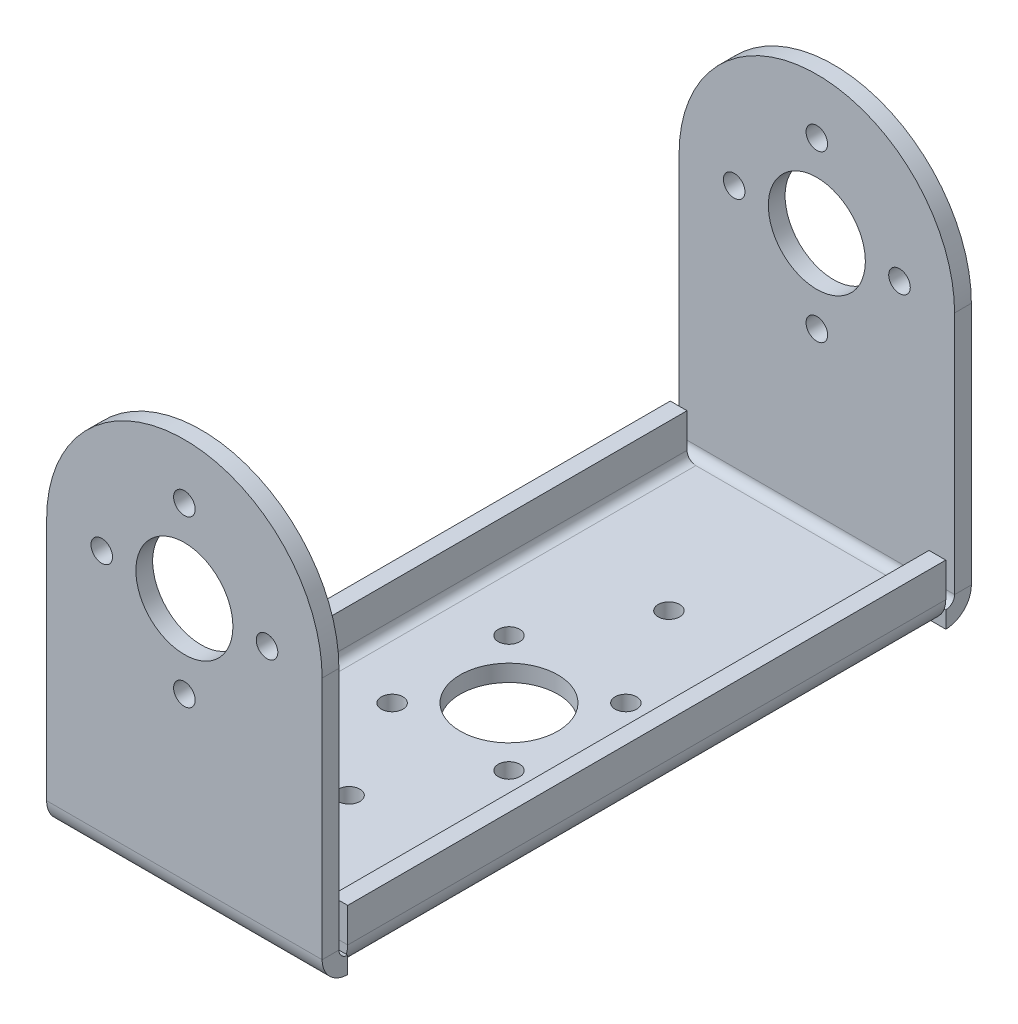
from build123d import *

# Parameters (mm, degrees)
BASE_FLANGE1_START             = -11.5
BASE_FLANGE1_DEPTH             = 23
EDGE_FLANGE1_STRIP_W           = 7.0732
EDGE_FLANGE1_STRIP_H           = 1.4
EDGE_FLANGE1_STRIP_CUT_DEPTH   = 49.9268
EDGE_FLANGE1_STRIP_2_W         = 7.0732
EDGE_FLANGE1_STRIP_2_H         = 1.4
EDGE_FLANGE1_STRIP_CUT_2_DEPTH = 49.9268
EDGE_FLANGE1_DEPTH             = 49.9268
EDGE_FLANGE1_BEND_DEPTH        = 49.9268
FILLET1_RADIUS                 = 11.5
FILLET1_LENGTH                 = 1.4
FILLET2_RADIUS                 = 11.5
FILLET2_LENGTH                 = 1.4
SKETCH12_R                     = 4.05
SKETCH12_R_2                   = 0.9
CUT_EXTRUDE1_DEPTH             = 66.006845793
SKETCH13_R                     = 4.075
SKETCH13_R_2                   = 0.9
CUT_EXTRUDE2_DEPTH             = 45.973992485


# Read off the part's stored shape, not the designer's step: Base-Flange1
# Sheet-metal steps are written as plain solids
with BuildPart() as part:
    # Base-Flange1 outline → Base-Flange1 (new body)
    with BuildSketch(Plane(origin=(0, 0, 0), x_dir=(0, 0, -1), z_dir=(1, 0, 0)).offset(BASE_FLANGE1_START)):
        with BuildLine():
            Line((27.1, 2.1366), (27.1, 34))
            Line((27.1, 34), (25.7, 34))
            Line((25.7, 34), (25.7, 2.1366))
            ThreePointArc((25.7, 2.1366), (25.484254855, 1.615745145), (24.9634, 1.4))
            Line((24.9634, 1.4), (-24.9634, 1.4))
            ThreePointArc((-24.9634, 1.4), (-25.484254855, 1.615745145), (-25.7, 2.1366))
            Line((-25.7, 2.1366), (-25.7, 34))
            Line((-25.7, 34), (-27.1, 34))
            Line((-27.1, 34), (-27.1, 2.1366))
            ThreePointArc((-27.1, 2.1366), (-26.474204349, 0.625795651), (-24.9634, 0))
            Line((-24.9634, 0), (24.9634, 0))
            ThreePointArc((24.9634, 0), (26.474204349, 0.625795651), (27.1, 2.1366))
        make_face()
    extrude(amount=BASE_FLANGE1_DEPTH)

    # Edge-Flange1 strip (across the edge) → Edge-Flange1 strip cut (cut)
    with BuildSketch(Plane(origin=(11.5, 1.4, 24.9634), x_dir=(-1, 0, 0), z_dir=(0, 0, -1))):
        with Locations((-1.4, -0.7)):
            Rectangle(EDGE_FLANGE1_STRIP_W, EDGE_FLANGE1_STRIP_H)
    extrude(amount=EDGE_FLANGE1_STRIP_CUT_DEPTH, mode=Mode.SUBTRACT)

    # Edge-Flange1 strip 2 (across the edge) → Edge-Flange1 strip cut 2 (cut)
    with BuildSketch(Plane(origin=(-11.5, 1.4, -24.9634), x_dir=(1, 0, 0), z_dir=(0, 0, 1))):
        with Locations((-1.4, -0.7)):
            Rectangle(EDGE_FLANGE1_STRIP_2_W, EDGE_FLANGE1_STRIP_2_H)
    extrude(amount=EDGE_FLANGE1_STRIP_CUT_2_DEPTH, mode=Mode.SUBTRACT)

    # Edge-Flange1 section (across the edge) → Edge-Flange1 (add)
    with BuildSketch(Plane(origin=(11.5, 1.4, 24.9634), x_dir=(-1, 0, 0), z_dir=(0, 0, -1))):
        with BuildLine():
            Line((0, 0.7366), (0, 3.6))
            Line((0, 3.6), (1.4, 3.6))
            Line((1.4, 3.6), (1.4, 0.7366))
            ThreePointArc((1.4, 0.7366), (1.615745145, 0.215745145), (2.1366, 0))
            Line((2.1366, 0), (2.1366, -1.4))
            ThreePointArc((2.1366, -1.4), (0.625795651, -0.774204349), (0, 0.7366))
        make_face()
    extrude(amount=EDGE_FLANGE1_DEPTH)

    # Edge-Flange1 section 2 (across the edge) → Edge-Flange1 bend (add)
    with BuildSketch(Plane(origin=(-11.5, 1.4, -24.9634), x_dir=(1, 0, 0), z_dir=(0, 0, 1))):
        with BuildLine():
            Line((0, 0.7366), (0, 3.6))
            Line((0, 3.6), (1.4, 3.6))
            Line((1.4, 3.6), (1.4, 0.7366))
            ThreePointArc((1.4, 0.7366), (1.615745145, 0.215745145), (2.1366, 0))
            Line((2.1366, 0), (2.1366, -1.4))
            ThreePointArc((2.1366, -1.4), (0.625795651, -0.774204349), (0, 0.7366))
        make_face()
    extrude(amount=EDGE_FLANGE1_BEND_DEPTH)

    # Fillet1: full round fillet: the end face becomes a half cylinder, R = half its width
    fillet1_face = Plane((0, 34, 26.4), x_dir=(0, 0, 1), z_dir=(0, 1, 0))  # on the end face: x along it, z out of the body
    fillet1_slab = fillet1_face.offset(-FILLET1_RADIUS / 2) * Box(FILLET1_LENGTH, 2 * FILLET1_RADIUS, FILLET1_RADIUS, mode=Mode.PRIVATE)  # the body's end, R deep
    fillet1_round = Plane((0, 22.5, 26.4), x_dir=(0, 1, 0), z_dir=(0, 0, 1)) * Cylinder(FILLET1_RADIUS, FILLET1_LENGTH, mode=Mode.PRIVATE)  # its axis R under the face
    add(fillet1_slab - fillet1_round, mode=Mode.SUBTRACT)

    # Fillet2: full round fillet: the end face becomes a half cylinder, R = half its width
    fillet2_face = Plane((0, 34, -26.4), x_dir=(0, 0, 1), z_dir=(0, 1, 0))  # on the end face: x along it, z out of the body
    fillet2_slab = fillet2_face.offset(-FILLET2_RADIUS / 2) * Box(FILLET2_LENGTH, 2 * FILLET2_RADIUS, FILLET2_RADIUS, mode=Mode.PRIVATE)  # the body's end, R deep
    fillet2_round = Plane((0, 22.5, -26.4), x_dir=(0, 1, 0), z_dir=(0, 0, 1)) * Cylinder(FILLET2_RADIUS, FILLET2_LENGTH, mode=Mode.PRIVATE)  # its axis R under the face
    add(fillet2_slab - fillet2_round, mode=Mode.SUBTRACT)

    # Sketch12 → Cut-Extrude1 (cut, through all)
    with BuildSketch(Plane.XY.offset(27.1)):
        with Locations((0, 22.5)):
            Circle(SKETCH12_R)
        with Locations((0, 29.4)):
            Circle(SKETCH12_R_2)
        with Locations((6.9, 22.5)):
            Circle(SKETCH12_R_2)
        with Locations((0, 15.6)):
            Circle(SKETCH12_R_2)
        with Locations((-6.9, 22.5)):
            Circle(SKETCH12_R_2)
    extrude(amount=-CUT_EXTRUDE1_DEPTH, mode=Mode.SUBTRACT)

    # Sketch13 → Cut-Extrude2 (cut, through all)
    with BuildSketch(Plane(origin=(0, 0, 0), x_dir=(1, 0, 0), z_dir=(0, 1, 0))):
        with Locations(Location((0, 0, 0), (0, 0, 270))):
            Circle(SKETCH13_R)
        with Locations(Location((-4.87903679, 4.87903679, 0), (0, 0, 270))):
            Circle(SKETCH13_R_2)
        with Locations(Location((4.87903679, 4.87903679, 0), (0, 0, 270))):
            Circle(SKETCH13_R_2)
        with Locations(Location((4.87903679, -4.87903679, 0), (0, 0, 270))):
            Circle(SKETCH13_R_2)
        with Locations(Location((-4.87903679, -4.87903679, 0), (0, 0, 270))):
            Circle(SKETCH13_R_2)
        with Locations(Location((0, 13.35, 0), (0, 0, 270))):
            Circle(SKETCH13_R_2)
        with Locations(Location((0, -13.35, 0), (0, 0, 90))):
            Circle(SKETCH13_R_2)
    extrude(amount=CUT_EXTRUDE2_DEPTH, mode=Mode.SUBTRACT)


solid = part.part
